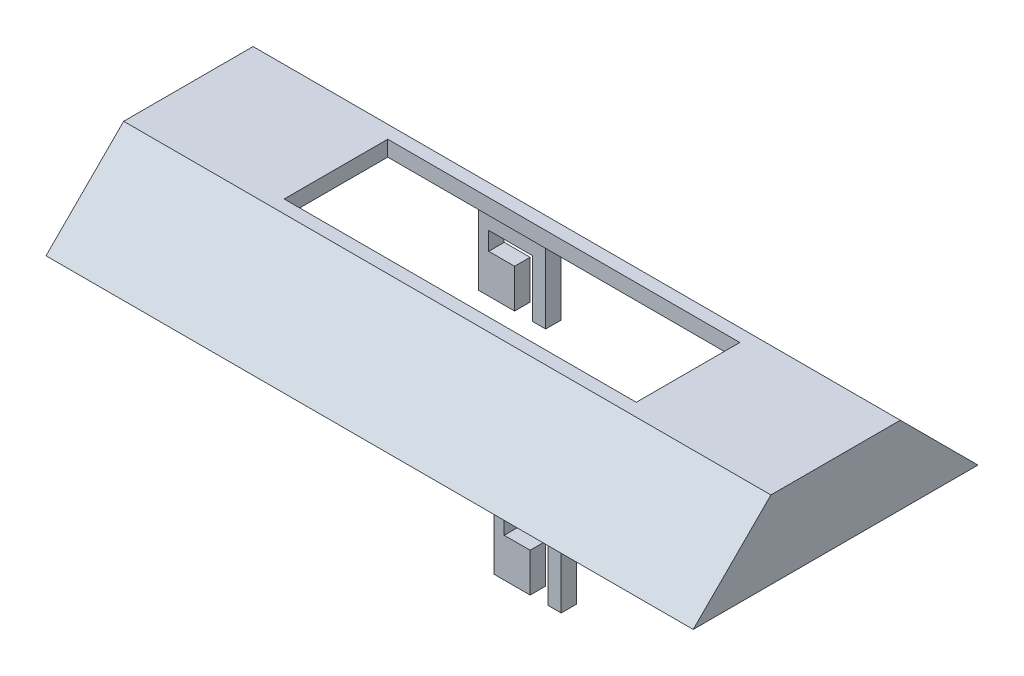
from build123d import *

# Parameters (mm, degrees)
SKETCH1_W           = 125
SKETCH1_H           = 55
BOSS_EXTRUDE1_DEPTH = 15
CHAMFER1_SIZE       = 15
SHELL1_START        = 3
SHELL1_DEPTH        = 119
SKETCH2_W           = 13
SKETCH2_H           = 3
BOSS_EXTRUDE3_DEPTH = 13
SKETCH3_W           = 3.5
SKETCH3_H           = 7.5
SKETCH3_W_2         = 8.5
SKETCH3_H_2         = 3.5
CUT_EXTRUDE1_DEPTH  = 13
SKETCH5_W           = 3.5
SKETCH5_H           = 7.5
SKETCH5_W_2         = 8.5
SKETCH5_H_2         = 3.5
CUT_EXTRUDE2_DEPTH  = 13
SKETCH6_W           = 68
SKETCH6_H           = 20
CUT_EXTRUDE3_DEPTH  = 3
SKETCH7_W           = 13
SKETCH7_H           = 1.757359313
BOSS_EXTRUDE4_DEPTH = 4
SKETCH8_W           = 13
SKETCH8_H           = 1.757359313
BOSS_EXTRUDE5_DEPTH = 4


# Read off the part's stored shape, not the designer's step: Shell1
with BuildPart() as part:
    # Sketch1 → Boss-Extrude1 (new body)
    with BuildSketch(Plane(origin=(0, 0, 0), x_dir=(1, 0, 0), z_dir=(0, 1, 0))):
        with Locations((62.5, -27.5)):
            Rectangle(SKETCH1_W, SKETCH1_H)
    extrude(amount=BOSS_EXTRUDE1_DEPTH)

    # Chamfer1
    chamfer1_edges = [part.edges().sort_by_distance(p)[0] for p in [
        (62.5, 15, 55),
        (62.5, 15, 0),
    ]]
    chamfer(chamfer1_edges, length=CHAMFER1_SIZE - 0.0001)  # a hair under: the kernel refuses the full size

    # Shell1 outline → Shell1 (cut)
    with BuildSketch(Plane.YZ.offset(SHELL1_START)):
        Polygon((0, 4.242640687), (12, 16.242640687), (12, 38.757359313), (0, 50.757359313), align=None)
    extrude(amount=SHELL1_DEPTH, mode=Mode.SUBTRACT)

    # Sketch2 → Boss-Extrude3 (add)
    with BuildSketch(Plane(origin=(0, 0, 0), x_dir=(-1, 0, 0), z_dir=(0, -1, 0))):
        with Locations((-41, -4.5)):
            Rectangle(SKETCH2_W, SKETCH2_H)
        with Locations((-90, -50.5)):
            Rectangle(SKETCH2_W, SKETCH2_H)
    extrude(amount=BOSS_EXTRUDE3_DEPTH)

    # Sketch3 → Cut-Extrude1 (cut)
    with BuildSketch(Plane.XY.offset(52)):
        with Locations((92.25, -9.25)):
            Rectangle(SKETCH3_W, SKETCH3_H)
        with Locations((89.75, -3.75)):
            Rectangle(SKETCH3_W_2, SKETCH3_H_2)
    extrude(amount=-CUT_EXTRUDE1_DEPTH, mode=Mode.SUBTRACT)

    # Sketch5 → Cut-Extrude2 (cut)
    with BuildSketch(Plane(origin=(0, 0, 3), x_dir=(-1, 0, 0), z_dir=(0, 0, -1))):
        with Locations((-43.25, -9.25)):
            Rectangle(SKETCH5_W, SKETCH5_H)
        with Locations((-40.75, -3.75)):
            Rectangle(SKETCH5_W_2, SKETCH5_H_2)
    extrude(amount=-CUT_EXTRUDE2_DEPTH, mode=Mode.SUBTRACT)

    # Sketch6 → Cut-Extrude3 (cut)
    with BuildSketch(Plane(origin=(0, 15, 0), x_dir=(1, 0, 0), z_dir=(0, 1, 0))):
        with Locations((62.5, -27.5)):
            Rectangle(SKETCH6_W, SKETCH6_H)
    extrude(amount=-CUT_EXTRUDE3_DEPTH, mode=Mode.SUBTRACT)

    # Sketch7 → Boss-Extrude4 (add)
    with BuildSketch(Plane(origin=(0, 0, 0), x_dir=(1, 0, 0), z_dir=(0, 1, 0))):
        with Locations((41, -5.121320344)):
            Rectangle(SKETCH7_W, SKETCH7_H)
    extrude(amount=BOSS_EXTRUDE4_DEPTH)

    # Sketch8 → Boss-Extrude5 (add)
    with BuildSketch(Plane(origin=(0, 0, 0), x_dir=(1, 0, 0), z_dir=(0, 1, 0))):
        with Locations((90, -49.878679656)):
            Rectangle(SKETCH8_W, SKETCH8_H)
    extrude(amount=BOSS_EXTRUDE5_DEPTH)


solid = part.part
